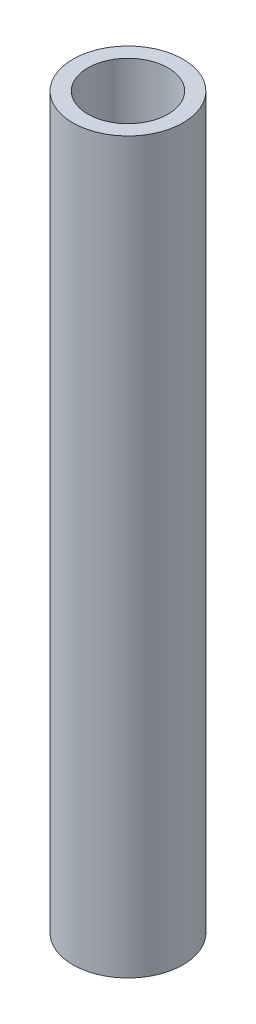
from build123d import *

# Parameters (mm, degrees)
SKETCH1_R           = 16.7005
SKETCH1_R_2         = 12.1539
BOSS_EXTRUDE1_DEPTH = 110.49


with BuildPart() as part:
    # Sketch1 → Boss-Extrude1 (new, symmetric)
    with BuildSketch(Plane(origin=(0, 0, 0), x_dir=(1, 0, 0), z_dir=(0, 1, 0))):
        Circle(SKETCH1_R)
        Circle(SKETCH1_R_2, mode=Mode.SUBTRACT)
    extrude(amount=BOSS_EXTRUDE1_DEPTH, both=True)


solid = part.part
